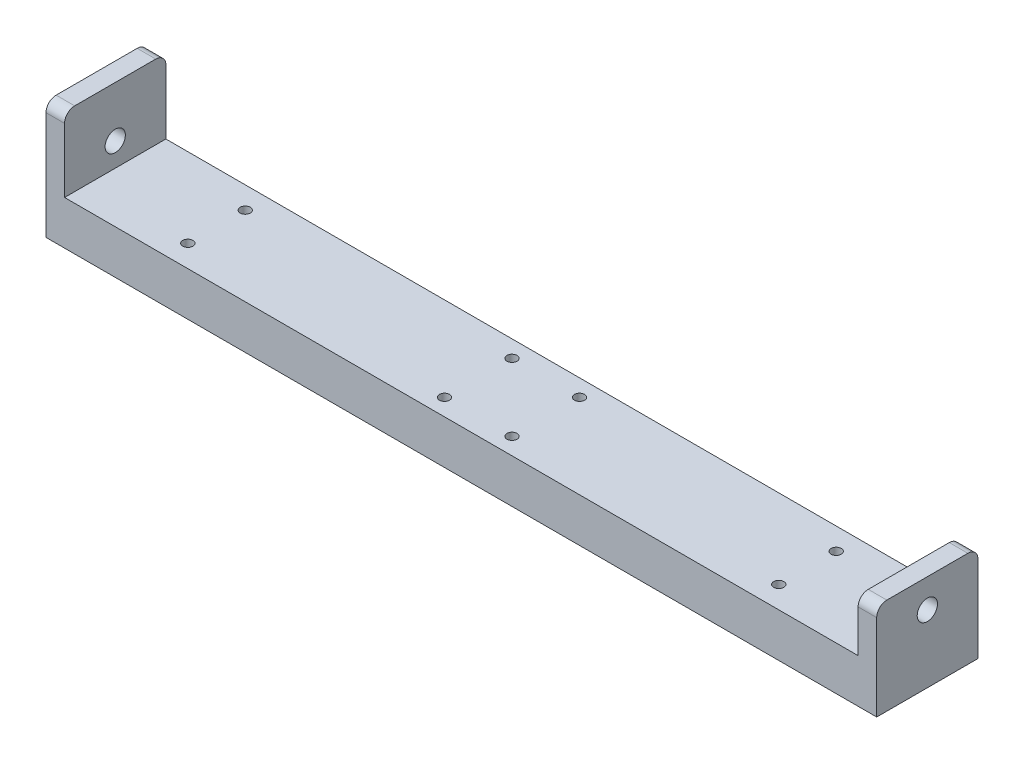
from build123d import *

# Parameters (mm, degrees)
EXTRUDE_1_DEPTH     = 15
CUT_EXTRUDE_1_REACH = 249.437
SKETCH_2_R          = 1.5
FILLET_2_R          = 3
SKETCH_3_R          = 3
CUT_EXTRUDE_2_DEPTH = 249.929708954


with BuildPart() as part:
    # 草图1 → 凸台-拉伸1 (new, symmetric)
    with BuildSketch(Plane.XY):
        Polygon((0, 0), (246, 0), (246, 28.5), (240.5, 28.5), (240.5, 13), (5.5, 13), (5.5, 35), (0, 35), align=None)
    extrude(amount=EXTRUDE_1_DEPTH, both=True)

    # 草图2 → 切除-拉伸1 (cut, up to next)
    with BuildSketch(Plane(origin=(0, 13, 0), x_dir=(1, 0, 0), z_dir=(0, 1, 0)), mode=Mode.PRIVATE) as cut_extrude_1_sk1:
        with Locations((35.5, 8.5)):
            Circle(SKETCH_2_R)
    cut_extrude_1_tool1 = extrude(cut_extrude_1_sk1.sketch, amount=-CUT_EXTRUDE_1_REACH, mode=Mode.PRIVATE) & part.part
    # 草图2 → 切除-拉伸1 (cut, up to next)
    with BuildSketch(Plane(origin=(0, 13, 0), x_dir=(1, 0, 0), z_dir=(0, 1, 0)), mode=Mode.PRIVATE) as cut_extrude_1_sk2:
        with Locations((210.5, 8.5)):
            Circle(SKETCH_2_R)
    cut_extrude_1_tool2 = extrude(cut_extrude_1_sk2.sketch, amount=-CUT_EXTRUDE_1_REACH, mode=Mode.PRIVATE) & part.part
    # 草图2 → 切除-拉伸1 (cut, up to next)
    with BuildSketch(Plane(origin=(0, 13, 0), x_dir=(1, 0, 0), z_dir=(0, 1, 0)), mode=Mode.PRIVATE) as cut_extrude_1_sk3:
        with Locations((35.5, -8.5)):
            Circle(SKETCH_2_R)
    cut_extrude_1_tool3 = extrude(cut_extrude_1_sk3.sketch, amount=-CUT_EXTRUDE_1_REACH, mode=Mode.PRIVATE) & part.part
    # 草图2 → 切除-拉伸1 (cut, up to next)
    with BuildSketch(Plane(origin=(0, 13, 0), x_dir=(1, 0, 0), z_dir=(0, 1, 0)), mode=Mode.PRIVATE) as cut_extrude_1_sk4:
        with Locations((210.5, -8.5)):
            Circle(SKETCH_2_R)
    cut_extrude_1_tool4 = extrude(cut_extrude_1_sk4.sketch, amount=-CUT_EXTRUDE_1_REACH, mode=Mode.PRIVATE) & part.part
    # 草图2 → 切除-拉伸1 (cut, up to next)
    with BuildSketch(Plane(origin=(0, 13, 0), x_dir=(1, 0, 0), z_dir=(0, 1, 0)), mode=Mode.PRIVATE) as cut_extrude_1_sk5:
        with Locations((113, 10)):
            Circle(SKETCH_2_R)
    cut_extrude_1_tool5 = extrude(cut_extrude_1_sk5.sketch, amount=-CUT_EXTRUDE_1_REACH, mode=Mode.PRIVATE) & part.part
    # 草图2 → 切除-拉伸1 (cut, up to next)
    with BuildSketch(Plane(origin=(0, 13, 0), x_dir=(1, 0, 0), z_dir=(0, 1, 0)), mode=Mode.PRIVATE) as cut_extrude_1_sk6:
        with Locations((133, 10)):
            Circle(SKETCH_2_R)
    cut_extrude_1_tool6 = extrude(cut_extrude_1_sk6.sketch, amount=-CUT_EXTRUDE_1_REACH, mode=Mode.PRIVATE) & part.part
    # 草图2 → 切除-拉伸1 (cut, up to next)
    with BuildSketch(Plane(origin=(0, 13, 0), x_dir=(1, 0, 0), z_dir=(0, 1, 0)), mode=Mode.PRIVATE) as cut_extrude_1_sk7:
        with Locations((133, -10)):
            Circle(SKETCH_2_R)
    cut_extrude_1_tool7 = extrude(cut_extrude_1_sk7.sketch, amount=-CUT_EXTRUDE_1_REACH, mode=Mode.PRIVATE) & part.part
    # 草图2 → 切除-拉伸1 (cut, up to next)
    with BuildSketch(Plane(origin=(0, 13, 0), x_dir=(1, 0, 0), z_dir=(0, 1, 0)), mode=Mode.PRIVATE) as cut_extrude_1_sk8:
        with Locations((113, -10)):
            Circle(SKETCH_2_R)
    cut_extrude_1_tool8 = extrude(cut_extrude_1_sk8.sketch, amount=-CUT_EXTRUDE_1_REACH, mode=Mode.PRIVATE) & part.part
    add(cut_extrude_1_tool1.solids().sort_by_distance((35.5, 13, -8.5))[0], mode=Mode.SUBTRACT)
    add(cut_extrude_1_tool2.solids().sort_by_distance((210.5, 13, -8.5))[0], mode=Mode.SUBTRACT)
    add(cut_extrude_1_tool3.solids().sort_by_distance((35.5, 13, 8.5))[0], mode=Mode.SUBTRACT)
    add(cut_extrude_1_tool4.solids().sort_by_distance((210.5, 13, 8.5))[0], mode=Mode.SUBTRACT)
    add(cut_extrude_1_tool5.solids().sort_by_distance((113, 13, -10))[0], mode=Mode.SUBTRACT)
    add(cut_extrude_1_tool6.solids().sort_by_distance((133, 13, -10))[0], mode=Mode.SUBTRACT)
    add(cut_extrude_1_tool7.solids().sort_by_distance((133, 13, 10))[0], mode=Mode.SUBTRACT)
    add(cut_extrude_1_tool8.solids().sort_by_distance((113, 13, 10))[0], mode=Mode.SUBTRACT)

    # 圆角2
    fillet_2_edges = [part.edges().sort_by_distance(p)[0] for p in [
        (243.25, 28.5, -15),
        (243.25, 28.5, 15),
        (2.75, 35, -15),
        (2.75, 35, 15),
    ]]
    fillet(fillet_2_edges, radius=FILLET_2_R)

    # 草图3 → 切除-拉伸2 (cut, through all)
    with BuildSketch(Plane.ZY):
        with Locations((0, 20)):
            Circle(SKETCH_3_R)
    extrude(amount=-CUT_EXTRUDE_2_DEPTH, mode=Mode.SUBTRACT)


solid = part.part
